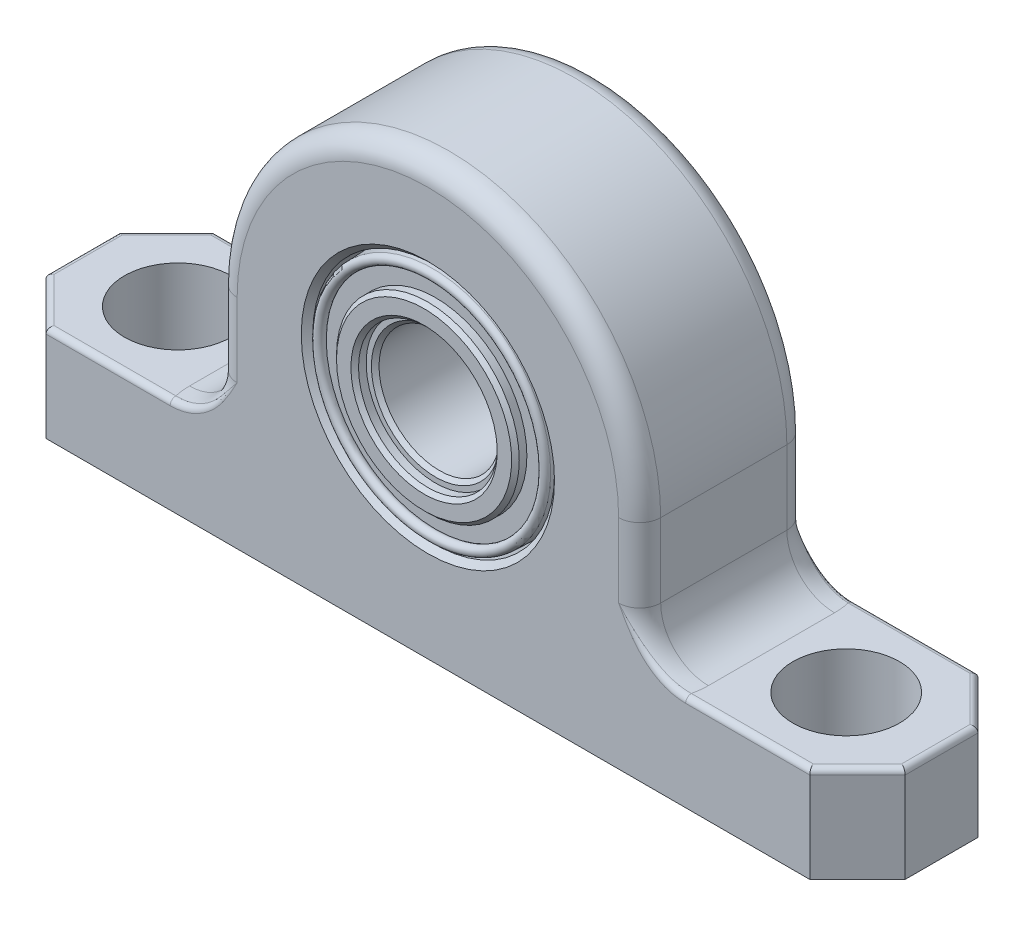
from build123d import *

# Parameters (mm, degrees)
BOSS_EXTRUDE1_DEPTH      = 5.6
BOSS_EXTRUDE1_DEPTH_BACK = 5.6
SKETCH3_R                = 8.049
SKETCH4_R                = 3.55
CUT_EXTRUDE1_DEPTH       = 41.832340124
CHAMFER1_SIZE            = 3.175
FILLET1_R                = 1.4
FILLET2_R                = 3.175
CHAMFER2_SIZE            = 0.381
FILLET3_R                = 0.381
CHAMFER3_SIZE            = 0.254


with BuildPart() as part:
    # Sketch3 → Boss-Extrude1 (new, two sides: drawn at the far end of the back side and taken through both)
    with BuildSketch(Plane.XY.offset(-BOSS_EXTRUDE1_DEPTH_BACK)):
        with BuildLine():
            Line((-28.6, 0), (-28.6, 6.4))
            Line((-28.6, 6.4), (-14.1, 6.4))
            Line((-14.1, 6.4), (-14.1, 14.5))
            ThreePointArc((-14.1, 14.5), (0, 28.6), (14.1, 14.5))
            Line((14.1, 14.5), (14.1, 6.4))
            Line((14.1, 6.4), (28.6, 6.4))
            Line((28.6, 6.4), (28.6, 0))
            Line((28.6, 0), (-28.6, 0))
        make_face()
        with Locations((0, 14.5)):
            Circle(SKETCH3_R, mode=Mode.SUBTRACT)
    extrude(amount=BOSS_EXTRUDE1_DEPTH + BOSS_EXTRUDE1_DEPTH_BACK)

    # Sketch4 → Cut-Extrude1 (cut, through all)
    with BuildSketch(Plane(origin=(0, 0, 0), x_dir=(1, 0, 0), z_dir=(0, 1, 0))):
        with Locations(Location((-22.25, 0, 0), (0, 0, 270))):
            Circle(SKETCH4_R)
        with Locations(Location((22.25, 0, 0), (0, 0, 180))):
            Circle(SKETCH4_R)
    extrude(amount=CUT_EXTRUDE1_DEPTH, mode=Mode.SUBTRACT)

    # Chamfer1
    chamfer1_edges = [part.edges().sort_by_distance(p)[0] for p in [
        (28.6, 3.2, 5.6),
        (-28.6, 3.2, -5.6),
        (-28.6, 3.2, 5.6),
        (28.6, 3.2, -5.6),
    ]]
    chamfer(chamfer1_edges, length=CHAMFER1_SIZE)

    # Fillet1
    fillet1_edges = [part.edges().sort_by_distance(p)[0] for p in [
        (14.1, 10.45, -5.6),
        (0, 28.6, -5.6),
        (-14.1, 10.45, -5.6),
        (14.1, 10.45, 5.6),
        (0, 28.6, 5.6),
        (-14.1, 10.45, 5.6),
    ]]
    fillet(fillet1_edges, radius=FILLET1_R)

    # Fillet2
    # the kernel refuses this fillet: 3.175 mm, written as the material it adds along each edge
    with BuildSketch(Plane(origin=(-14.1, 6.4, 4.2), x_dir=(-1, 0, 0), z_dir=(0, 0, -1))) as fillet2_piece_1:
        with BuildLine():
            CenterArc((FILLET2_R, FILLET2_R), FILLET2_R, 180, 90)
            Line((0, FILLET2_R), (0, 0))
            Line((0, 0), (FILLET2_R, 0))
        make_face()
    extrude(amount=8.4)
    with BuildSketch(Plane(origin=(14.1, 6.4, 4.2), x_dir=(1, 0, 0), z_dir=(0, 0, -1))) as fillet2_piece_2:
        with BuildLine():
            CenterArc((FILLET2_R, -FILLET2_R), FILLET2_R, 90, 90)
            Line((0, -FILLET2_R), (0, 0))
            Line((0, 0), (FILLET2_R, 0))
        make_face()
    extrude(amount=8.4)
    with BuildSketch(Plane(origin=(-12.7, 6.4, -4.2), x_dir=(-0.9999802608561371, 0, 0.006283143965558777), z_dir=(-0.006283143965558777, 0, -0.9999802608561371))) as fillet2_piece_3_section:
        with BuildLine():
            CenterArc((1.4 + FILLET2_R, FILLET2_R), FILLET2_R, 180, 90)
            Line((1.4, FILLET2_R), (1.4, 0))
            Line((1.4, 0), (1.4 + FILLET2_R, 0))
        make_face()
    fillet2_piece_3 = revolve(axis=Axis((-12.7, 6.4, -4.2), (0, 1, 0)), revolution_arc=359.64, mode=Mode.PRIVATE)
    fillet2_piece_3 = split(fillet2_piece_3, bisect_by=Plane(origin=(-12.7, 6.4, -5.6), z_dir=(0, 0, 1)), keep=Keep.TOP, mode=Mode.PRIVATE)
    add(fillet2_piece_3)
    with BuildSketch(Plane(origin=(-12.7, 6.4, 4.2), x_dir=(-0.9999802608561371, 0, -0.006283143965558777), z_dir=(-0.006283143965558777, 0, 0.9999802608561371))) as fillet2_piece_4_section:
        with BuildLine():
            CenterArc((1.4 + FILLET2_R, -FILLET2_R), FILLET2_R, 90, 90)
            Line((1.4, -FILLET2_R), (1.4, 0))
            Line((1.4, 0), (1.4 + FILLET2_R, 0))
        make_face()
    fillet2_piece_4 = revolve(axis=Axis((-12.7, 6.4, 4.2), (0, -1, 0)), revolution_arc=359.64, mode=Mode.PRIVATE)
    fillet2_piece_4 = split(fillet2_piece_4, bisect_by=Plane(origin=(-12.7, 6.4, 5.6), z_dir=(0, 0, -1)), keep=Keep.TOP, mode=Mode.PRIVATE)
    add(fillet2_piece_4)
    with BuildSketch(Plane(origin=(12.7, 6.4, -4.2), x_dir=(0.9999802608561371, 0, 0.006283143965558777), z_dir=(0.006283143965558777, 0, -0.9999802608561371))) as fillet2_piece_5_section:
        with BuildLine():
            CenterArc((1.4 + FILLET2_R, -FILLET2_R), FILLET2_R, 90, 90)
            Line((1.4, -FILLET2_R), (1.4, 0))
            Line((1.4, 0), (1.4 + FILLET2_R, 0))
        make_face()
    fillet2_piece_5 = revolve(axis=Axis((12.7, 6.4, -4.2), (0, -1, 0)), revolution_arc=359.64, mode=Mode.PRIVATE)
    fillet2_piece_5 = split(fillet2_piece_5, bisect_by=Plane(origin=(12.7, 6.4, -5.6), z_dir=(0, 0, 1)), keep=Keep.TOP, mode=Mode.PRIVATE)
    add(fillet2_piece_5)
    with BuildSketch(Plane(origin=(12.7, 6.4, 4.2), x_dir=(0.9999802608561371, 0, -0.006283143965558777), z_dir=(0.006283143965558777, 0, 0.9999802608561371))) as fillet2_piece_6_section:
        with BuildLine():
            CenterArc((1.4 + FILLET2_R, FILLET2_R), FILLET2_R, 180, 90)
            Line((1.4, FILLET2_R), (1.4, 0))
            Line((1.4, 0), (1.4 + FILLET2_R, 0))
        make_face()
    fillet2_piece_6 = revolve(axis=Axis((12.7, 6.4, 4.2), (0, 1, 0)), revolution_arc=359.64, mode=Mode.PRIVATE)
    fillet2_piece_6 = split(fillet2_piece_6, bisect_by=Plane(origin=(12.7, 6.4, 5.6), z_dir=(0, 0, -1)), keep=Keep.TOP, mode=Mode.PRIVATE)
    add(fillet2_piece_6)

    # Chamfer2
    chamfer2_edges = [part.edges().sort_by_distance(p)[0] for p in [
        (-8.049, 14.5, -5.6),
        (-8.049, 14.5, 5.6),
    ]]
    chamfer(chamfer2_edges, length=CHAMFER2_SIZE)

    # Fillet3
    fillet3_edges = [part.edges().sort_by_distance(p)[0] for p in [
        (-21.240264048, 6.4, -5.6),
        (-21.240264048, 6.4, 5.6),
        (-14.4783641, 7.398599024, -5.6),
        (-14.4783641, 7.398599024, 5.6),
        (14.4783641, 7.398599024, -5.6),
        (14.4783641, 7.398599024, 5.6),
        (-28.6, 6.4, 0),
        (21.240264048, 6.4, -5.6),
        (-27.0125, 6.4, 4.0125),
        (-27.0125, 6.4, -4.0125),
        (21.240264048, 6.4, 5.6),
        (28.6, 6.4, 0),
        (27.0125, 6.4, -4.0125),
        (27.0125, 6.4, 4.0125),
    ]]
    fillet(fillet3_edges, radius=FILLET3_R)


with BuildPart() as body_2:
    # Sketch6 → Revolve1 (revolve)
    with BuildSketch(Plane(origin=(0, 0, 0), x_dir=(0, 0, -1), z_dir=(1, 0, 0)), mode=Mode.PRIVATE) as revolve1_sk:
        with BuildLine():
            Line((0, 22.549), (5.6, 22.549))
            Line((5.6, 22.549), (5.6, 21.772752844))
            Line((5.6, 21.772752844), (1.79, 21.772752844))
            Line((1.79, 21.772752844), (1.79, 20.584159091))
            Line((1.79, 20.584159091), (4.33, 20.584159091))
            Line((4.33, 20.584159091), (4.33, 19.11725))
            Line((4.33, 19.11725), (3.568, 19.11725))
            Line((3.568, 19.11725), (3.568, 18.515))
            Line((3.568, 18.515), (-5.092, 18.515))
            Line((-5.092, 18.515), (-5.092, 19.11725))
            Line((-5.092, 19.11725), (-5.854, 19.11725))
            Line((-5.854, 19.11725), (-5.854, 20.584159091))
            Line((-5.854, 20.584159091), (-5.092, 20.584159091))
            Line((-5.092, 20.584159091), (-5.092, 21.772752844))
            ThreePointArc((-5.092, 21.772752844), (-5.583707431, 21.938668821), (-5.286929074, 22.364376368))
            Line((-5.286929074, 22.364376368), (0, 22.549))
        make_face()
    revolve(revolve1_sk.sketch.rotate(Axis((0, 14.5, 5.6), (0, 0, -1)), 90), axis=Axis((0, 14.5, 5.6), (0, 0, -1)))

    # Chamfer3
    chamfer3_edges = [body_2.edges().sort_by_distance(p)[0] for p in [
        (-6.084159091, 14.5, -4.33),
        (-4.61725, 14.5, -4.33),
        (-4.015, 14.5, -3.568),
        (-4.015, 14.5, 5.092),
        (-4.61725, 14.5, 5.854),
        (-6.084159091, 14.5, 5.854),
    ]]
    chamfer(chamfer3_edges, length=CHAMFER3_SIZE)


solid = Compound([part.part, body_2.part])
